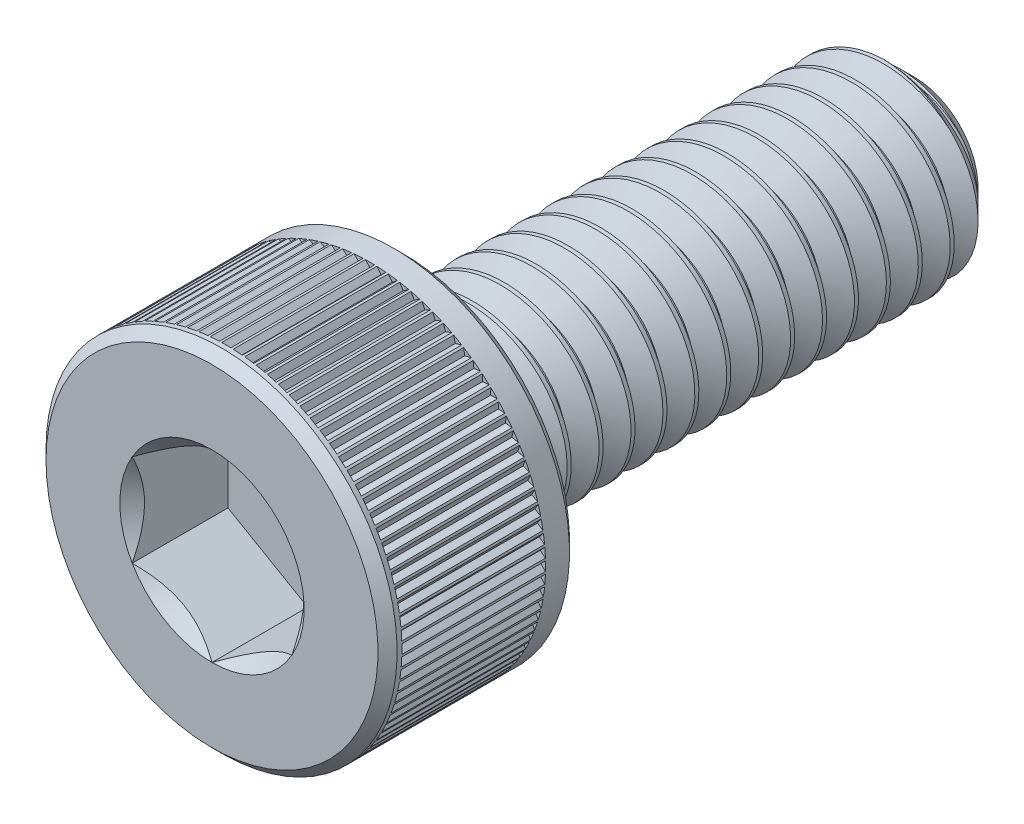
from build123d import *

# Parameters (mm, degrees)
CUT_EXTRUDE1_START = -1.5
CUT_EXTRUDE1_DEPTH = 1.5
SKETCH4_R          = 1.443375673
CUT_EXTRUDE2_DEPTH = 0.5
CUT_EXTRUDE2_DRAFT = -45
CUT_SWEEP1_PITCH   = 0.5
CUT_EXTRUDE4_START = -0.975
CUT_EXTRUDE4_DEPTH = 2.25
CIRPATTERN2_COUNT  = 96


# Read off the part's stored shape, not the designer's step: Split1, Boss-Extrude1
with BuildPart() as part:
    # Sketch2 → Revolve1 (revolve)
    with BuildSketch(Plane(origin=(0, 0, 0), x_dir=(0, 0, -1), z_dir=(1, 0, 0)), mode=Mode.PRIVATE) as revolve1_sk:
        Polygon((-5.35, 2.75), (-2.65, 2.75), (-2.5, 2.6), (-2.5, 1.5), (5, 1.5), (5.5, 1), (5.5, 0), (-5.5, 0), (-5.5, 2.6), align=None)
    revolve(revolve1_sk.sketch.rotate(Axis((0, 0, -5.5), (0, 0, 1)), 90), axis=Axis((0, 0, -5.5), (0, 0, 1)))

    # Sketch3 → Cut-Extrude1 (cut)
    with BuildSketch(Plane.XY.offset(5.5).offset(CUT_EXTRUDE1_START)):
        Polygon((0, 1.443375673), (-1.25, 0.721687836), (-1.25, -0.721687836), (0, -1.443375673), (1.25, -0.721687836), (1.25, 0.721687836), align=None)
    extrude(amount=CUT_EXTRUDE1_DEPTH, mode=Mode.SUBTRACT)


with BuildPart() as cut_extrude2_tool:
    # Sketch4 → Cut-Extrude2 (with draft: the straight prism first)
    with BuildSketch(Plane.XY.offset(5.5)):
        Circle(SKETCH4_R)
    extrude(amount=-CUT_EXTRUDE2_DEPTH)
    # Cut-Extrude2: the draft: its side faces are tilted about the plane it starts from
    cut_extrude2_sides = [cut_extrude2_tool.faces().sort_by_distance(p)[0] for p in [
        (-1.443375673, 0, 5.25),
    ]]
    draft(cut_extrude2_sides, Plane.XY.offset(5.5), CUT_EXTRUDE2_DRAFT)


with BuildPart() as part_1:
    add(part.part)

    # Cut-Extrude2: cut by cut_extrude2_tool
    add(cut_extrude2_tool.part, mode=Mode.SUBTRACT)


with BuildPart() as body_2:
    # Split1: the piece on the far side of the plane
    add(part_1.part)
    split(bisect_by=Plane.XY.offset(2.5), keep=Keep.BOTTOM)

    # Cut-Sweep1: the profile of Sketch7 screwed along a right-hand helix of 17 turns, 6 arcs to a turn; built about Z, then put on its axis
    cut_sweep1_z = Axis((0, 0, 0), (0, 0, 1))
    cut_sweep1_corners = [(1.527063294, 0, 0.015625), (1.527063294, 0, -0.453125), (1.175240474, 0, -0.25), (1.175240474, 0, -0.1875)]
    with BuildLine(mode=Mode.PRIVATE) as cut_sweep1_profile:
        Line(cut_sweep1_corners[0], cut_sweep1_corners[1])
        Line(cut_sweep1_corners[1], cut_sweep1_corners[2])
        Line(cut_sweep1_corners[2], cut_sweep1_corners[3])
        Line(cut_sweep1_corners[3], cut_sweep1_corners[0])
    cut_sweep1_cap = Face(cut_sweep1_profile.wire())
    cut_sweep1_turn_angles = [0, 30, 60, 90, 120, 150, 180, 210, 240, 270, 300, 330, 360]
    cut_sweep1_turn_weights = [1, 0.8660254037844387, 1, 0.8660254037844387, 1, 0.8660254037844387, 1, 0.8660254037844387, 1, 0.8660254037844387, 1, 0.8660254037844387, 1]
    cut_sweep1_turn_rails = [Edge.make_bspline([Vector(p[0], p[1], 0).rotate(cut_sweep1_z, cut_sweep1_turn_angles[k]) / cut_sweep1_turn_weights[k] + Vector(0, 0, p[2] + CUT_SWEEP1_PITCH * cut_sweep1_turn_angles[k] / 360) for k in range(13)], [0, 0, 0, 1, 1, 2, 2, 3, 3, 4, 4, 5, 5, 6, 6, 6], 2, cut_sweep1_turn_weights) for p in cut_sweep1_corners]
    cut_sweep1_turn_sides = [Face.make_surface_from_curves(cut_sweep1_turn_rails[p[0]], cut_sweep1_turn_rails[p[1]]) for p in [(0, 1), (1, 2), (2, 3), (3, 0)]]
    cut_sweep1 = Plane(origin=(0, 0, -5.5), x_dir=(0, 1, 0), z_dir=(0, 0, 1)) * Solid(Shell([*[p.moved(Location((0, 0, CUT_SWEEP1_PITCH * i))) for i in range(17) for p in cut_sweep1_turn_sides], cut_sweep1_cap, cut_sweep1_cap.rotate(cut_sweep1_z, 6120).moved(Location((0, 0, CUT_SWEEP1_PITCH * 6120 / 360)))]))
    add(cut_sweep1, mode=Mode.SUBTRACT)


with BuildPart() as part_2:
    add(part_1.part)

    # Split1
    split(bisect_by=Plane.XY.offset(2.5), keep=Keep.TOP)

    add(body_2.part)  # Boss-Extrude1 merges body 2
    # Boss-Extrude1 outline → Boss-Extrude1 (revolve)
    with BuildSketch(Plane.XZ):
        Polygon((1.175238158, 2.5), (1.175238158, 2.175238158), (1.5, 2.5), align=None)
    revolve(axis=Axis((0, 0, 0), (0, 0, 1)))

    # Sketch9 → Cut-Extrude4 (cut)
    with BuildSketch(Plane.XY.offset(4).offset(CUT_EXTRUDE4_START)):
        with BuildLine():
            Line((0, 2.674375), (0.071986608, 2.749057644))
            ThreePointArc((0.071986608, 2.749057644), (0, 2.75), (-0.071986608, 2.749057644))
            Line((-0.071986608, 2.749057644), (0, 2.674375))
        make_face()
    cut_extrude4 = extrude(amount=CUT_EXTRUDE4_DEPTH, mode=Mode.SUBTRACT)

    # CirPattern2: Cut-Extrude4 ×96 about axis
    cirpattern2_axis = Axis((0, 0, 0), (0, 0, 1))
    for i in range(1, CIRPATTERN2_COUNT):
        add(cut_extrude4.rotate(cirpattern2_axis, i * 360 / CIRPATTERN2_COUNT), mode=Mode.SUBTRACT)


solid = part_2.part
